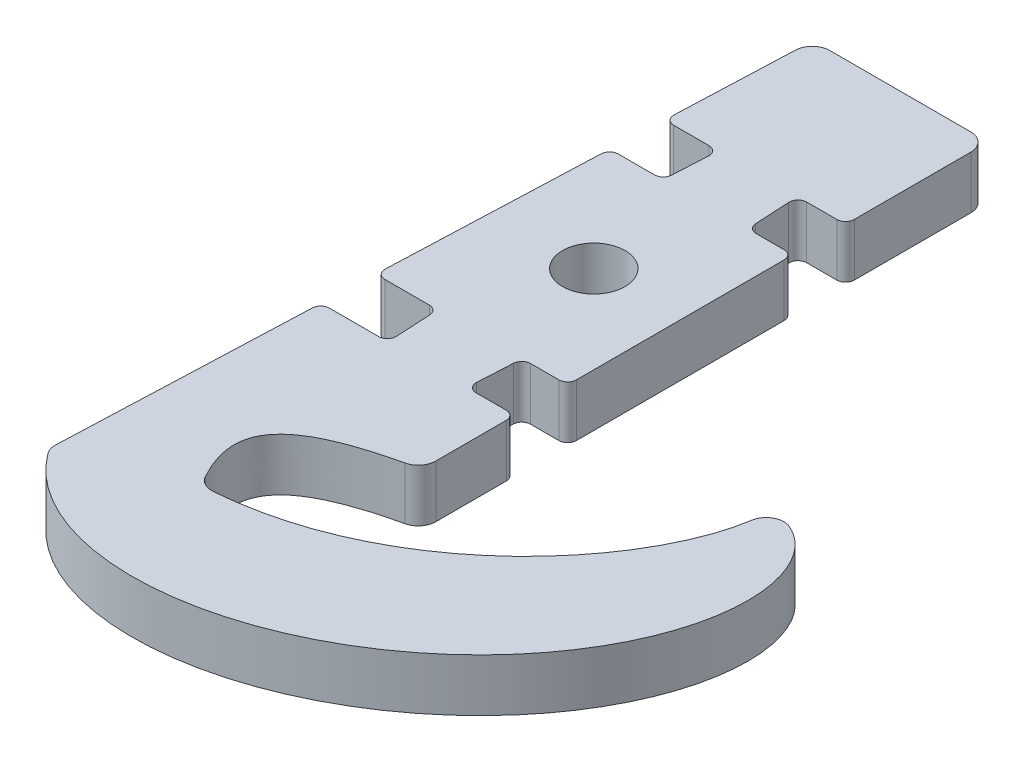
from build123d import *

# Parameters (mm, degrees)
BOSS_EXTRUDE1_OUTLINE_R = 1.783761197
BOSS_EXTRUDE1_DEPTH     = 3
CUT_EXTRUDE1_REACH      = 37.306
FILLET1_R               = 1
FILLET2_R               = 0.5


# Read off the part's stored shape, not the designer's step: Boss-Extrude1
with BuildPart() as part:
    # Boss-Extrude1 outline → Boss-Extrude1 (new body)
    with BuildSketch(Plane(origin=(0, 0, 0), x_dir=(1, 0, 0), z_dir=(0, 1, 0))):
        with BuildLine():
            Line((5, 17.5), (-5, 17.5))
            Line((-5, 17.5), (-6.648887471, -24.389894135))
            add(Edge.make_bspline(
                [(-6.648887471, -24.389894135), (-1.79761276, -31.734966706), (13.203728073, -30.957119403), (24.864765464, -19.062433132), (22.884297555, -6.902852925), (17.013261533, -6.902852925)],
                knots=[0, 0, 0, 0, 0, 0, 1, 1, 1, 1, 1, 1], degree=5))
            add(Edge.make_bspline(
                [(17.013261533, -6.902852925), (17.013261533, -12.122390468), (10.158000359, -21.42084271), (-0.482101901, -21.901454261)],
                knots=[0, 0, 0, 0, 1, 1, 1, 1], degree=3))
            add(Edge.make_bspline(
                [(-0.482101901, -21.901454261), (-2.603887856, -18.477971621), (-1.981580223, -16.222106451), (5, -14.821914277)],
                knots=[0, 0, 0, 0, 1, 1, 1, 1], degree=3))
            Line((5, -14.821914277), (5, 17.5))
        make_face()
        Circle(BOSS_EXTRUDE1_OUTLINE_R, mode=Mode.SUBTRACT)
    extrude(amount=BOSS_EXTRUDE1_DEPTH)

    # Sketch2 → Cut-Extrude1 (cut, up to next)
    with BuildSketch(Plane(origin=(0, 3, 0), x_dir=(1, 0, 0), z_dir=(0, 1, 0)), mode=Mode.PRIVATE) as cut_extrude1_sk1:
        Polygon((-5.438617253, 6.356953165), (-2.423349926, 6.356953165), (-2.259422797, 9.356953165), (-5.320530003, 9.356953165), align=None)
    cut_extrude1_tool1 = extrude(cut_extrude1_sk1.sketch, amount=-CUT_EXTRUDE1_REACH, mode=Mode.PRIVATE) & part.part
    # Sketch2 → Cut-Extrude1 (cut, up to next)
    with BuildSketch(Plane(origin=(0, 3, 0), x_dir=(1, 0, 0), z_dir=(0, 1, 0)), mode=Mode.PRIVATE) as cut_extrude1_sk2:
        Polygon((5, 6.356953165), (2.423349926, 6.356953165), (2.259422797, 9.356953165), (5, 9.356953165), align=None)
    cut_extrude1_tool2 = extrude(cut_extrude1_sk2.sketch, amount=-CUT_EXTRUDE1_REACH, mode=Mode.PRIVATE) & part.part
    # Sketch2 → Cut-Extrude1 (cut, up to next)
    with BuildSketch(Plane(origin=(0, 3, 0), x_dir=(1, 0, 0), z_dir=(0, 1, 0)), mode=Mode.PRIVATE) as cut_extrude1_sk3:
        Polygon((-5.944453926, -6.493799271), (-2.41587233, -6.493799271), (-2.2519452, -9.493799271), (-6.062541177, -9.493799271), align=None)
    cut_extrude1_tool3 = extrude(cut_extrude1_sk3.sketch, amount=-CUT_EXTRUDE1_REACH, mode=Mode.PRIVATE) & part.part
    # Sketch2 → Cut-Extrude1 (cut, up to next)
    with BuildSketch(Plane(origin=(0, 3, 0), x_dir=(1, 0, 0), z_dir=(0, 1, 0)), mode=Mode.PRIVATE) as cut_extrude1_sk4:
        Polygon((5, -6.493799271), (2.41587233, -6.493799271), (2.2519452, -9.493799271), (5, -9.493799271), align=None)
    cut_extrude1_tool4 = extrude(cut_extrude1_sk4.sketch, amount=-CUT_EXTRUDE1_REACH, mode=Mode.PRIVATE) & part.part
    add(cut_extrude1_tool1.solids().sort_by_distance((-3.860303, 3, -7.860725))[0], mode=Mode.SUBTRACT)
    add(cut_extrude1_tool2.solids().sort_by_distance((3.670272, 3, -7.872368))[0], mode=Mode.SUBTRACT)
    add(cut_extrude1_tool3.solids().sort_by_distance((-4.168556, 3, 8.013012))[0], mode=Mode.SUBTRACT)
    add(cut_extrude1_tool4.solids().sort_by_distance((3.666534, 3, 8.009171))[0], mode=Mode.SUBTRACT)

    # Fillet1
    fillet1_edges = [part.edges().sort_by_distance(p)[0] for p in [
        (-5, 1.5, -17.5),
        (5, 1.5, -17.5),
        (5, 1.5, 14.821914277),
        (-6.648887471, 1.5, 24.389894135),
        (17.013261533, 1.5, 6.902852925),
        (-0.482101901, 1.5, 21.901454261),
    ]]
    fillet(fillet1_edges, radius=FILLET1_R)

    # Fillet2
    fillet2_edges = [part.edges().sort_by_distance(p)[0] for p in [
        (5, 1.5, -9.356953165),
        (5, 1.5, -6.356953165),
        (2.423349926, 1.5, -6.356953165),
        (2.259422797, 1.5, -9.356953165),
        (-6.062541177, 1.5, 9.493799271),
        (-5.944453926, 1.5, 6.493799271),
        (-2.41587233, 1.5, 6.493799271),
        (-2.2519452, 1.5, 9.493799271),
        (5, 1.5, 6.493799271),
        (5, 1.5, 9.493799271),
        (2.2519452, 1.5, 9.493799271),
        (2.41587233, 1.5, 6.493799271),
        (-5.438617253, 1.5, -6.356953165),
        (-5.320530003, 1.5, -9.356953165),
        (-2.259422797, 1.5, -9.356953165),
        (-2.423349926, 1.5, -6.356953165),
    ]]
    fillet(fillet2_edges, radius=FILLET2_R)


solid = part.part
